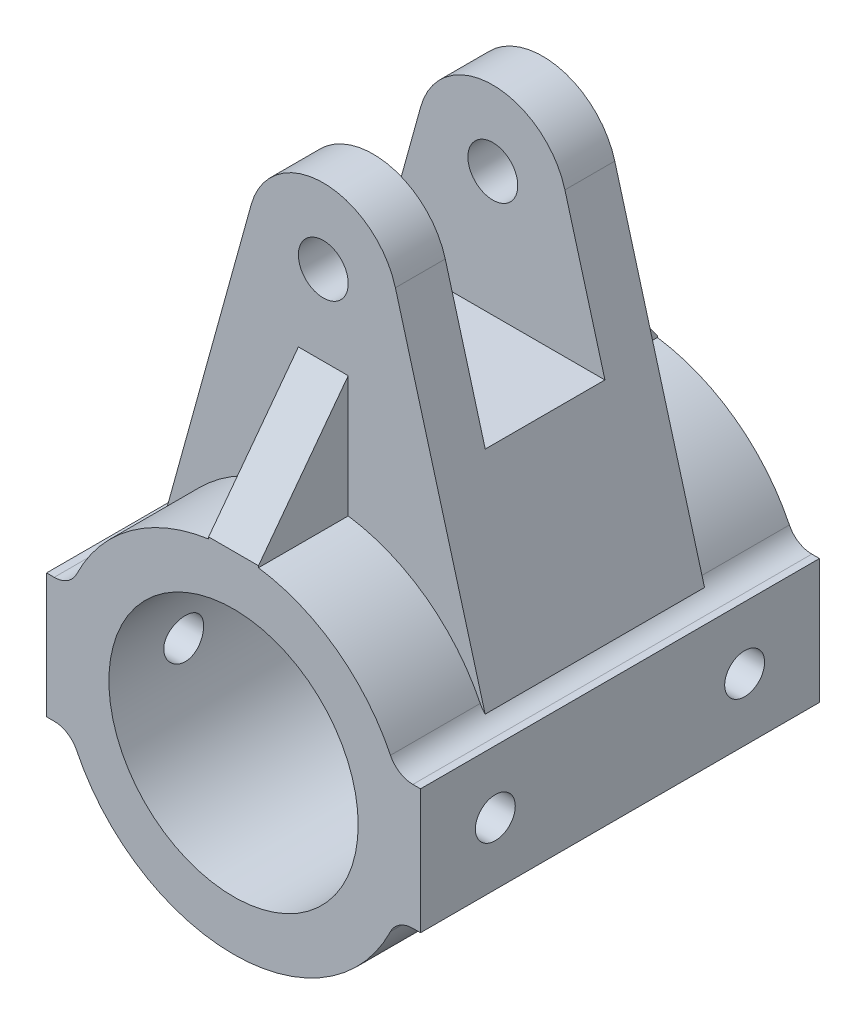
from build123d import *

# Parameters (mm, degrees)
SKETCH1_R                       = 35
BOSS_EXTRUDE1_DEPTH             = 40
SKETCH2_R                       = 5
BOSS_EXTRUDE2_DEPTH             = 22
BOSS_EXTRUDE3_DEPTH             = 5
HOLE1_D                         = 50
BOSS_EXTRUDE4_REACH             = 106.523
SKETCH7_W                       = 75
SKETCH7_H                       = 25
BOSS_EXTRUDE4_DIRECTION_2_REACH = 106.523
HOLE2_D                         = 50
CUT_EXTRUDE1_DEPTH              = 106.386194542
CUT_EXTRUDE1_DEPTH_BACK         = 106.386194542
SKETCH11_W                      = 24
SKETCH11_H                      = 40
HOLE3_D                         = 8
FILLET1_R                       = 5


with BuildPart() as part:
    # Sketch1 → Boss-Extrude1 (new, symmetric)
    with BuildSketch(Plane.XY):
        Circle(SKETCH1_R)
    extrude(amount=BOSS_EXTRUDE1_DEPTH, both=True)

    # Sketch2 → Boss-Extrude2 (add, symmetric)
    with BuildSketch(Plane.XY):
        with BuildLine():
            Line((-33.732608688, 9.333333333), (-14.456832295, 79))
            ThreePointArc((-14.456832295, 79), (0, 90), (14.456832295, 79))
            Line((14.456832295, 79), (33.732608688, 9.333333333))
            ThreePointArc((33.732608688, 9.333333333), (0, 35), (-33.732608688, 9.333333333))
        make_face()
        with Locations((0, 75)):
            Circle(SKETCH2_R, mode=Mode.SUBTRACT)
    extrude(amount=BOSS_EXTRUDE2_DEPTH, both=True)

    # Sketch3 → Boss-Extrude3 (add, symmetric)
    with BuildSketch(Plane(origin=(0, 0, 0), x_dir=(0, 0, -1), z_dir=(1, 0, 0))):
        Polygon((-40, 35), (-22, 59), (22, 59), (40, 35), (40, 0), (-40, 0), align=None)
    extrude(amount=BOSS_EXTRUDE3_DEPTH, both=True)

    # Hole1 (through all)
    with Locations(Plane.XY.offset(40)):
        with Locations((0, 0)):
            Hole(HOLE1_D / 2)

    # Boss-Extrude4: up to this face of the body (flat: up to its plane)
    boss_extrude4_end = Plane(part.part.faces().sort_by_distance((0, -34.010050506, -40))[0])
    # Sketch7 → Boss-Extrude4 (add, up to the picked face)
    with BuildSketch(Plane.XY, mode=Mode.PRIVATE) as boss_extrude4_sk1:
        Rectangle(SKETCH7_W, SKETCH7_H)
    boss_extrude4_tool1 = split(extrude(boss_extrude4_sk1.sketch, amount=-BOSS_EXTRUDE4_REACH, mode=Mode.PRIVATE), bisect_by=boss_extrude4_end, keep=Keep.BOTH, mode=Mode.PRIVATE)
    add(boss_extrude4_tool1.solids().sort_by(Axis((0, 0, 0), (0, 0, -1)))[0])

    # Boss-Extrude4 direction 2: up to this face of the body (flat: up to its plane)
    boss_extrude4_direction_2_end = Plane(part.part.faces().sort_by_distance((0, -34.010050506, 40))[0])
    # Sketch7 → Boss-Extrude4 direction 2 (add, up to the picked face)
    with BuildSketch(Plane.XY, mode=Mode.PRIVATE) as boss_extrude4_direction_2_sk1:
        Rectangle(SKETCH7_W, SKETCH7_H)
    boss_extrude4_direction_2_tool1 = split(extrude(boss_extrude4_direction_2_sk1.sketch, amount=BOSS_EXTRUDE4_DIRECTION_2_REACH, mode=Mode.PRIVATE), bisect_by=boss_extrude4_direction_2_end, keep=Keep.BOTH, mode=Mode.PRIVATE)
    add(boss_extrude4_direction_2_tool1.solids().sort_by(Axis((0, 0, 0), (0, 0, 1)))[0])

    # Hole2 (through all)
    with Locations(Plane.XY.offset(40)):
        with Locations((0, 0)):
            Hole(HOLE2_D / 2)

    # Sketch11 → Cut-Extrude1 (cut, two sides: drawn at the far end of the back side and taken through both)
    with BuildSketch(Plane(origin=(0, 0, 0), x_dir=(0, 0, -1), z_dir=(1, 0, 0)).offset(-CUT_EXTRUDE1_DEPTH_BACK)):
        with Locations((0, 70)):
            Rectangle(SKETCH11_W, SKETCH11_H)
    extrude(amount=CUT_EXTRUDE1_DEPTH + CUT_EXTRUDE1_DEPTH_BACK, mode=Mode.SUBTRACT)

    # Hole3 (through all)
    with Locations(Plane(origin=(37.5, 0, 0), x_dir=(0, 0, -1), z_dir=(1, 0, 0))):
        with Locations((-25, 0), (25, 0)):
            Hole(HOLE3_D / 2)

    # Fillet1
    fillet1_edges = [part.edges().sort_by_distance(p)[0] for p in [
        (-32.691742077, 12.5, 31),
    ]]
    fillet(fillet1_edges, radius=FILLET1_R - 0.0001)  # a hair under: the kernel refuses the full size
    fillet1_2_edges = [part.edges().sort_by_distance(p)[0] for p in [
        (32.691742077, 12.5, 31),
    ]]
    fillet(fillet1_2_edges, radius=FILLET1_R)
    fillet1_3_edges = [part.edges().sort_by_distance(p)[0] for p in [
        (-32.691742077, -12.5, 0),
    ]]
    fillet(fillet1_3_edges, radius=FILLET1_R)
    fillet1_4_edges = [part.edges().sort_by_distance(p)[0] for p in [
        (32.691742077, -12.5, 0),
    ]]
    fillet(fillet1_4_edges, radius=FILLET1_R)


solid = part.part
